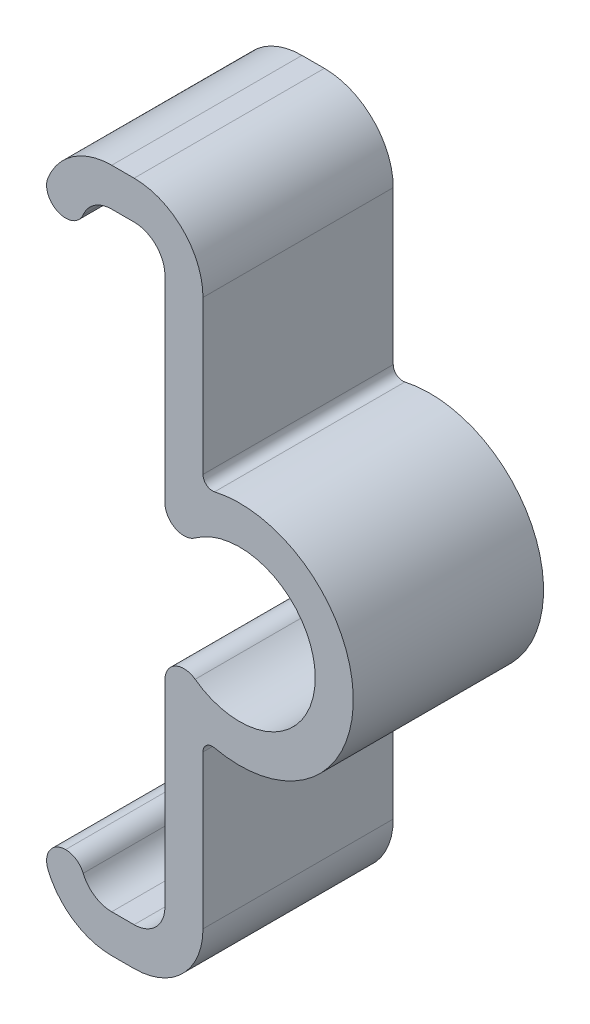
from build123d import *

# Parameters (mm, degrees)
BOSS_EXTRUDE1_DEPTH = 10
FILLET1_R           = 1
FILLET2_R           = 0.5
FILLET3_R           = 1


with BuildPart() as part:
    # Sketch1 → Boss-Extrude1 (new body)
    with BuildSketch(Plane.XY):
        with BuildLine():
            Line((0.05, 14.37), (0.05, 4.504997225))
            ThreePointArc((0.05, 4.504997225), (0.993882062, 5.178181229), (2.05, 5.65641229))
            Line((2.05, 5.65641229), (2.05, 14.37))
            ThreePointArc((2.05, 14.37), (0.989726548, 16.929726548), (-1.57, 17.99))
            Line((-1.57, 17.99), (-2.748, 17.99))
            ThreePointArc((-2.748, 17.99), (-5.307726548, 16.929726548), (-6.368, 14.37))
            Line((-6.368, 14.37), (-4.368, 14.37))
            ThreePointArc((-4.368, 14.37), (-3.893512986, 15.515512986), (-2.748, 15.99))
            Line((-2.748, 15.99), (-1.57, 15.99))
            ThreePointArc((-1.57, 15.99), (-0.424487014, 15.515512986), (0.05, 14.37))
        make_face()
        with BuildLine():
            Line((0.05, -0.628490254), (0.05, -4.504997225))
            ThreePointArc((0.05, -4.504997225), (0.993882062, -5.178181229), (2.05, -5.65641229))
            Line((2.05, -5.65641229), (2.05, -3.477786652))
            ThreePointArc((2.05, -3.477786652), (0.721502268, -2.283720103), (0.05, -0.628490254))
        make_face()
        with BuildLine():
            ThreePointArc((2.05, 5.65641229), (0.993882062, 5.178181229), (0.05, 4.504997225))
            Line((0.05, 4.504997225), (0.05, 0.628490254))
            ThreePointArc((0.05, 0.628490254), (0.721502268, 2.283720103), (2.05, 3.477786652))
            Line((2.05, 3.477786652), (2.05, 5.65641229))
        make_face()
        with BuildLine():
            Line((2.05, -3.477786652), (2.05, -5.65641229))
            ThreePointArc((2.05, -5.65641229), (7.453415588, -4.858111773), (9.95, 0))
            ThreePointArc((9.95, 0), (7.453415588, 4.858111773), (2.05, 5.65641229))
            Line((2.05, 5.65641229), (2.05, 3.477786652))
            ThreePointArc((2.05, 3.477786652), (5.993508112, 3.424361254), (7.95, 0))
            ThreePointArc((7.95, 0), (5.993508112, -3.424361254), (2.05, -3.477786652))
        make_face()
        with BuildLine():
            Line((-1.57, -15.99), (-2.748, -15.99))
            ThreePointArc((-2.748, -15.99), (-3.893512986, -15.515512986), (-4.368, -14.37))
            Line((-4.368, -14.37), (-6.368, -14.37))
            ThreePointArc((-6.368, -14.37), (-5.307726548, -16.929726548), (-2.748, -17.99))
            Line((-2.748, -17.99), (-1.57, -17.99))
            ThreePointArc((-1.57, -17.99), (0.989726548, -16.929726548), (2.05, -14.37))
            Line((2.05, -14.37), (2.05, -5.65641229))
            ThreePointArc((2.05, -5.65641229), (0.993882062, -5.178181229), (0.05, -4.504997225))
            Line((0.05, -4.504997225), (0.05, -14.37))
            ThreePointArc((0.05, -14.37), (-0.424487014, -15.515512986), (-1.57, -15.99))
        make_face()
    extrude(amount=BOSS_EXTRUDE1_DEPTH)

    # Fillet1
    fillet1_edges = [part.edges().sort_by_distance(p)[0] for p in [
        (0.05, -0.628490254, 5),
        (0.05, 0.628490254, 5),
    ]]
    fillet(fillet1_edges, radius=FILLET1_R)

    # Fillet2
    fillet2_edges = [part.edges().sort_by_distance(p)[0] for p in [
        (2.05, 5.65641229, 5),
        (2.05, -5.65641229, 5),
    ]]
    fillet(fillet2_edges, radius=FILLET2_R)

    # Fillet3
    fillet3_edges = [part.edges().sort_by_distance(p)[0] for p in [
        (-6.368, 14.37, 5),
        (-4.368, 14.37, 5),
        (-6.368, -14.37, 5),
        (-4.368, -14.37, 5),
    ]]
    fillet(fillet3_edges, radius=FILLET3_R - 0.0001)  # a hair under: the kernel refuses the full size


solid = part.part
